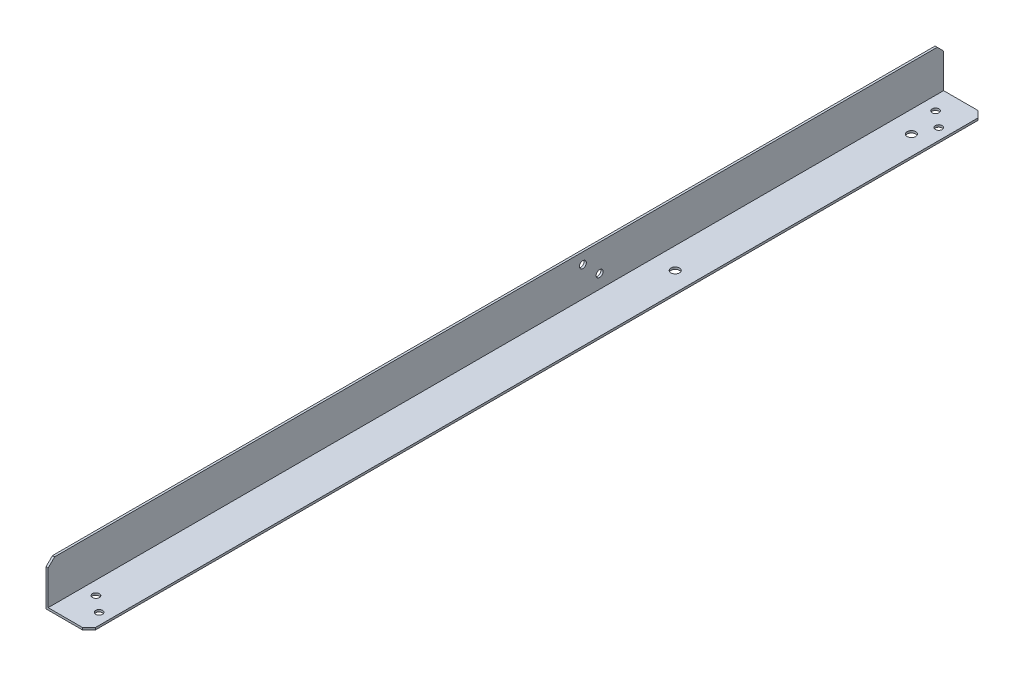
from build123d import *

# Parameters (mm, degrees)
BASE_DEPTH                      = 417
CHAMFER1_SIZE                   = 3
F_3_2_3_2_CABLE_CARRIER_HOLES_D = 3.2
F_3_2_3_2_DIAMETER_HOLE2_D      = 3.2
F_4_0_4_CABLE_TIE_HOLES_D       = 4


with BuildPart() as part:
    # Sketch1 → Base (new body)
    with BuildSketch(Plane.XY):
        Polygon((0, 0), (20, 0), (20, 1), (1, 1), (1, 20), (0, 20), align=None)
    extrude(amount=BASE_DEPTH)

    # Chamfer1
    chamfer1_edges = [part.edges().sort_by_distance(p)[0] for p in [
        (20, 0.5, 417),
        (0.5, 20, 417),
        (0.5, 20, 0),
        (20, 0.5, 0),
    ]]
    chamfer(chamfer1_edges, length=CHAMFER1_SIZE)

    # Ø3.2 (3.2) Cable Carrier Holes (through all)
    with Locations(Plane(origin=(1, 0, 0), x_dir=(0, 0, -1), z_dir=(1, 0, 0))):
        with Locations((-168, 14.85), (-160.2, 7.35)):
            Hole(F_3_2_3_2_CABLE_CARRIER_HOLES_D / 2)

    # Ø3.2 (3.2) Diameter Hole2 (through all)
    with Locations(Plane(origin=(0, 1, 0), x_dir=(1, 0, 0), z_dir=(0, 1, 0))):
        with Locations((7.25, -401), (14.75, -407), (7.25, -10), (14.75, -16)):
            Hole(F_3_2_3_2_DIAMETER_HOLE2_D / 2)

    # Ø4.0 (4) Cable Tie Holes (through all)
    with Locations(Plane(origin=(0, 1, 0), x_dir=(1, 0, 0), z_dir=(0, 1, 0))):
        with Locations((11, -25), (11, -135)):
            Hole(F_4_0_4_CABLE_TIE_HOLES_D / 2)


solid = part.part
